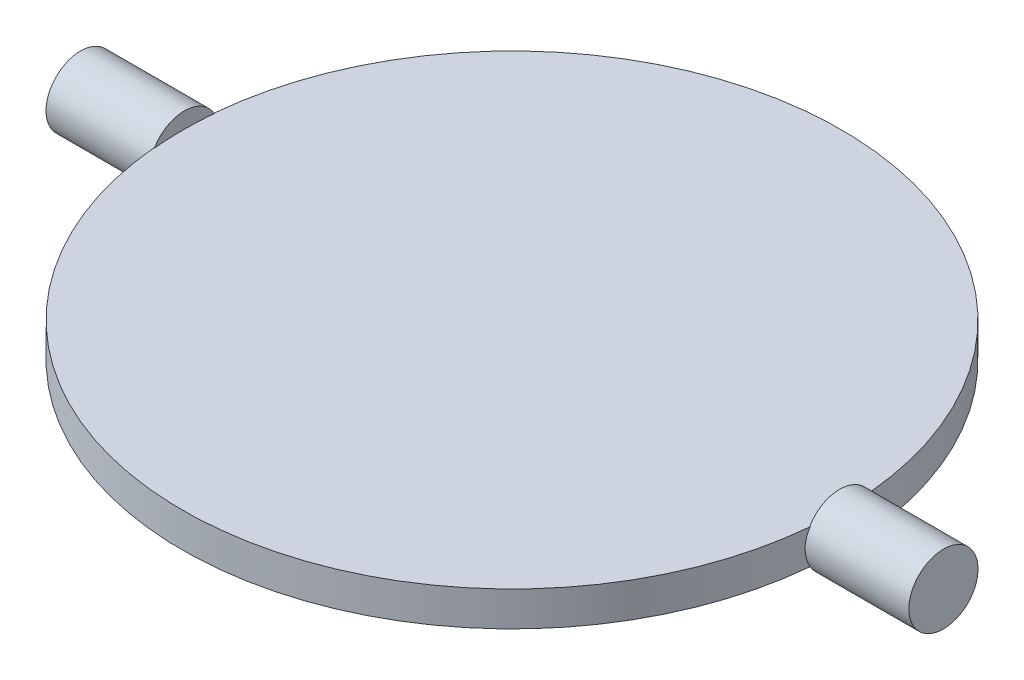
from build123d import *

# Parameters (mm, degrees)
BOSS_EXTRUDE1_DEPTH = 2


with BuildPart() as part:
    # Sketch1 → Boss-Extrude1 (new, symmetric)
    with BuildSketch(Plane(origin=(0, 0, 0), x_dir=(1, 0, 0), z_dir=(0, 1, 0))):
        with BuildLine():
            ThreePointArc((37.88944444, 4), (0, 38.1), (-37.88944444, 4))
            ThreePointArc((-37.88944444, 4), (-38.047324697, 2.002768936), (-38.1, 0))
            ThreePointArc((-38.1, 0), (-38.047324697, -2.002768936), (-37.88944444, -4))
            ThreePointArc((-37.88944444, -4), (0, -38.1), (37.88944444, -4))
            ThreePointArc((37.88944444, -4), (38.047324697, -2.002768936), (38.1, 0))
            ThreePointArc((38.1, 0), (38.047324697, 2.002768936), (37.88944444, 4))
        make_face()
    extrude(amount=BOSS_EXTRUDE1_DEPTH, both=True)

    # Sketch1<6> → Revolve1 (revolve)
    with BuildSketch(Plane(origin=(0, 0, 0), x_dir=(1, 0, 0), z_dir=(0, 1, 0))):
        with BuildLine():
            Line((-38.1, 0), (-49.88944444, 0))
            Line((-49.88944444, 0), (-49.88944444, -4))
            Line((-49.88944444, -4), (-37.88944444, -4))
            ThreePointArc((-37.88944444, -4), (-38.047324697, -2.002768936), (-38.1, 0))
        make_face()
        with BuildLine():
            Line((49.88944444, 0), (38.1, 0))
            ThreePointArc((38.1, 0), (38.047324697, -2.002768936), (37.88944444, -4))
            Line((37.88944444, -4), (49.88944444, -4))
            Line((49.88944444, -4), (49.88944444, 0))
        make_face()
    revolve(axis=Axis((-76.43543075, 0, 0), (1, 0, 0)))


solid = part.part
